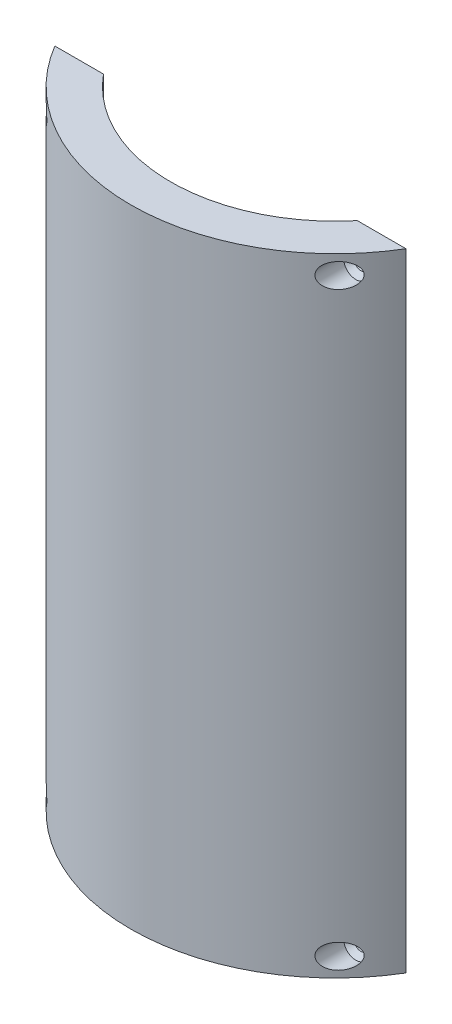
from build123d import *

# Parameters (mm, degrees)
BOSS_EXTRUDE1_DEPTH = 150


with BuildPart() as part:
    # Sketch1 → Boss-Extrude1 (new body)
    with BuildSketch(Plane(origin=(0, 0, 0), x_dir=(1, 0, 0), z_dir=(0, 1, 0))):
        with BuildLine():
            ThreePointArc((30.348758021, -25.07), (0, -39.364349524), (-30.348758021, -25.07))
            Line((-30.348758021, -25.07), (-41.978758021, -25.07))
            ThreePointArc((-41.978758021, -25.07), (0, -48.895), (41.978758021, -25.07))
            Line((41.978758021, -25.07), (30.348758021, -25.07))
        make_face()
    extrude(amount=BOSS_EXTRUDE1_DEPTH)

    # Sketch6 → Cut-Revolve4 (revolve, cut)
    with BuildSketch(Plane(origin=(34.962080117, 4.5125, 25.07), x_dir=(-1, 0, 0), z_dir=(0, -1, 0))):
        Polygon((0, 1.685394277), (0, -4.78184701), (0, -15.185924704), (-2.9, -15.185924704), (-2.9, -4.968389004), (-1.65, -3.771328265), (-1.65, 1.685394277), align=None)
    cut_revolve4 = revolve(axis=Axis((34.962080117, 4.5125, 23.384605723), (0, 0, 1)), mode=Mode.SUBTRACT)

    # Mirror1: Cut-Revolve4 across plane
    add(cut_revolve4.mirror(Plane(origin=(0, 75, 0), x_dir=(0, 0, 1), z_dir=(0, -1, 0))), mode=Mode.SUBTRACT)

    # Mirror1 at the second plane: Cut-Revolve4 across plane
    add(cut_revolve4.mirror(Plane(origin=(0, 0, 0), x_dir=(0, 0, 1), z_dir=(1, 0, 0))), mode=Mode.SUBTRACT)

    # Mirror1 at the second plane copy 1 sketc → Mirror1 at the second plane copy 1 (revolve, cut)
    with BuildSketch(Plane(origin=(-34.962080117, 145.4875, 25.07), x_dir=(1, 0, 0), z_dir=(0, 1, 0))):
        Polygon((0, 1.685394277), (0, -4.78184701), (0, -15.185924704), (-2.9, -15.185924704), (-2.9, -4.968389004), (-1.65, -3.771328265), (-1.65, 1.685394277), align=None)
    revolve(axis=Axis((-34.962080117, 145.4875, 23.384605723), (0, 0, 1)), mode=Mode.SUBTRACT)


solid = part.part
